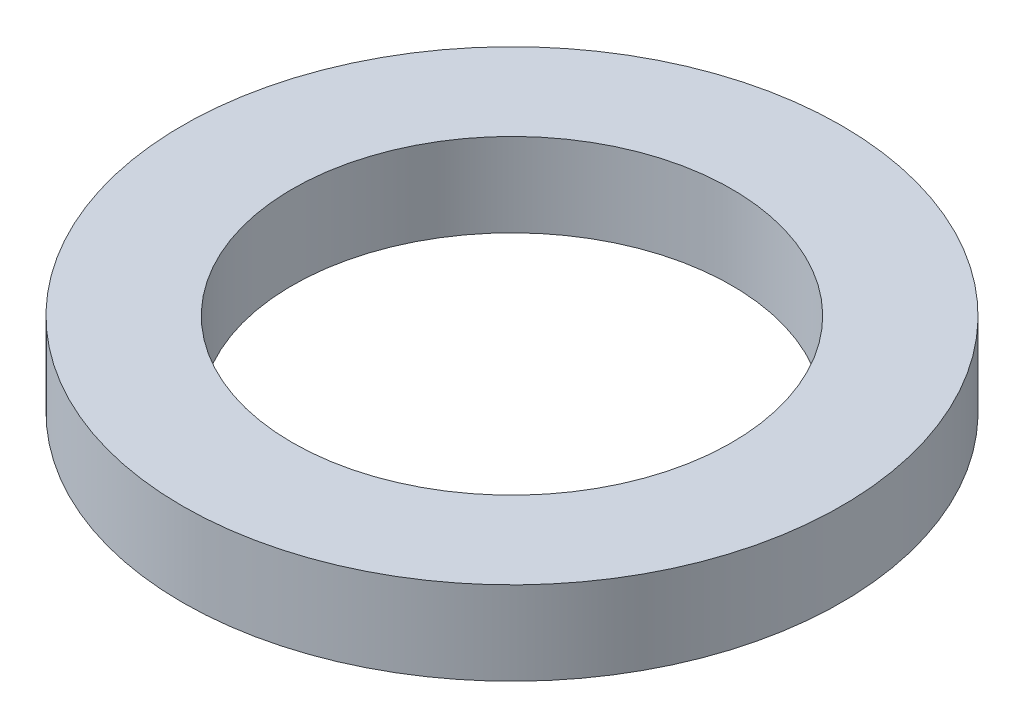
from build123d import *

# Parameters (mm, degrees)
SKETCH1_R           = 75
BOSS_EXTRUDE1_DEPTH = 19
SKETCH2_R           = 50
CUT_EXTRUDE1_DEPTH  = 108.75435026


with BuildPart() as part:
    # Sketch1 → Boss-Extrude1 (new body)
    with BuildSketch(Plane(origin=(0, 0, 0), x_dir=(1, 0, 0), z_dir=(0, 1, 0))):
        Circle(SKETCH1_R)
    extrude(amount=BOSS_EXTRUDE1_DEPTH)

    # Sketch2 → Cut-Extrude1 (cut, through all)
    with BuildSketch(Plane(origin=(0, 0, 0), x_dir=(1, 0, 0), z_dir=(0, 1, 0))):
        Circle(SKETCH2_R)
    extrude(amount=CUT_EXTRUDE1_DEPTH, mode=Mode.SUBTRACT)


solid = part.part
